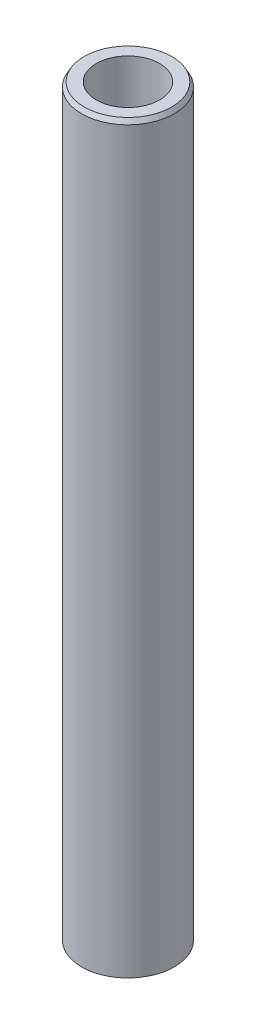
from build123d import *
from OCP.BRepFilletAPI import BRepFilletAPI_MakeChamfer

# Parameters (mm, degrees)
SKETCH1_R           = 27.5
BOSS_EXTRUDE1_DEPTH = 442.30214911
SKETCH2_R           = 18.757621961
CUT_EXTRUDE1_DEPTH  = 445.008661072
CHAMFER1_SIZE       = 2.689539456
CHAMFER1_SIZE2      = 1.552806329


with BuildPart() as part:
    # Sketch1 → Boss-Extrude1 (new body)
    with BuildSketch(Plane(origin=(0, 0, 0), x_dir=(1, 0, 0), z_dir=(0, 1, 0))):
        Circle(SKETCH1_R)
    extrude(amount=BOSS_EXTRUDE1_DEPTH)

    # Sketch2 → Cut-Extrude1 (cut, through all)
    with BuildSketch(Plane(origin=(0, 0, 0), x_dir=(1, 0, 0), z_dir=(0, 1, 0))):
        Circle(SKETCH2_R)
    extrude(amount=CUT_EXTRUDE1_DEPTH, mode=Mode.SUBTRACT)

    # Chamfer1: one chamfer whose edges measure the first distance from different faces: ONE call of the kernel's chamfer builder (chamfer() names one face for all edges)
    chamfer1_edges_1 = [part.edges().sort_by_distance(p)[0] for p in [
        (-27.5, 442.30214911, 0),
    ]]
    chamfer1_side_1 = [part.faces().sort_by_distance(p)[0] for p in [
        (-27.5, 221.151074555, 0),
    ]]
    chamfer1_edges_2 = [part.edges().sort_by_distance(p)[0] for p in [
        (-27.5, 0, 0),
    ]]
    chamfer1_side_2 = [part.faces().sort_by_distance(p)[0] for p in [
        (-26.722182541, 0, 0),
    ]]
    chamfer1 = BRepFilletAPI_MakeChamfer(part.part.solid().wrapped)
    for e in chamfer1_edges_1:
        chamfer1.Add(CHAMFER1_SIZE, CHAMFER1_SIZE2, e.wrapped, chamfer1_side_1[0].wrapped)  # the first distance lies on this face
    for e in chamfer1_edges_2:
        chamfer1.Add(CHAMFER1_SIZE, CHAMFER1_SIZE2, e.wrapped, chamfer1_side_2[0].wrapped)  # the first distance lies on this face
    add(Compound.cast(chamfer1.Shape()), mode=Mode.REPLACE)


solid = part.part
